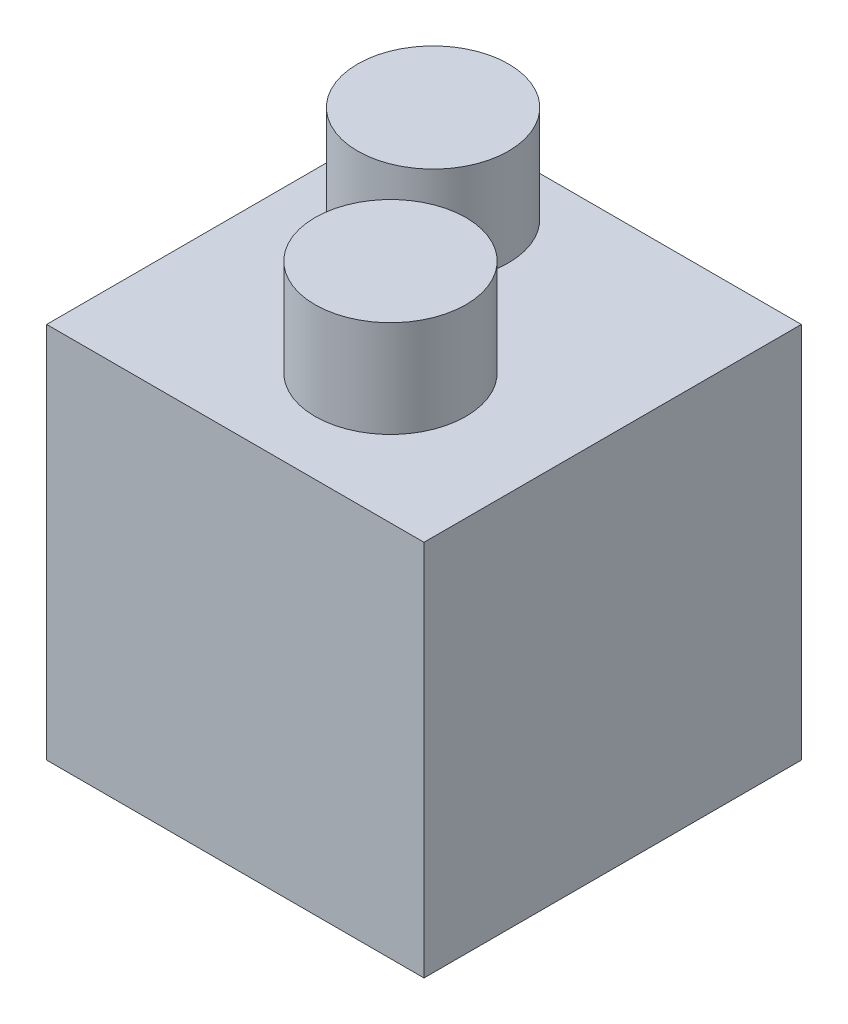
from build123d import *

# Parameters (mm, degrees)
ESQUISSE1_W        = 20
ESQUISSE1_H        = 20
BOSS_EXTRU_1_DEPTH = 20
ESQUISSE2_R        = 4
BOSS_EXTRU_2_DEPTH = 5
ESQUISSE2_2_R      = 4
BOSS_EXTRU_3_DEPTH = 15


with BuildPart() as part:
    # Esquisse1 → Boss.-Extru.1 (new body)
    with BuildSketch(Plane.XY):
        with Locations((19.870278818, -0.129721182)):
            Rectangle(ESQUISSE1_W, ESQUISSE1_H)
    extrude(amount=BOSS_EXTRU_1_DEPTH)

    # Esquisse2 → Boss.-Extru.2 (add)
    with BuildSketch(Plane(origin=(0, 0, 0), x_dir=(1, 0, 0), z_dir=(0, 1, 0))):
        with Locations((15.284551457, -4.932289283)):
            Circle(ESQUISSE2_R)
        with Locations((21.206061262, -13.112235386)):
            Circle(ESQUISSE2_R)
    extrude(amount=BOSS_EXTRU_2_DEPTH)

    # Esquisse2<2> → Boss.-Extru.3 (add)
    with BuildSketch(Plane(origin=(0, 0, 0), x_dir=(1, 0, 0), z_dir=(0, 1, 0))):
        with Locations((15.284551457, -4.932289283)):
            Circle(ESQUISSE2_2_R)
        with Locations((21.206061262, -13.112235386)):
            Circle(ESQUISSE2_2_R)
    extrude(amount=BOSS_EXTRU_3_DEPTH)


solid = part.part
